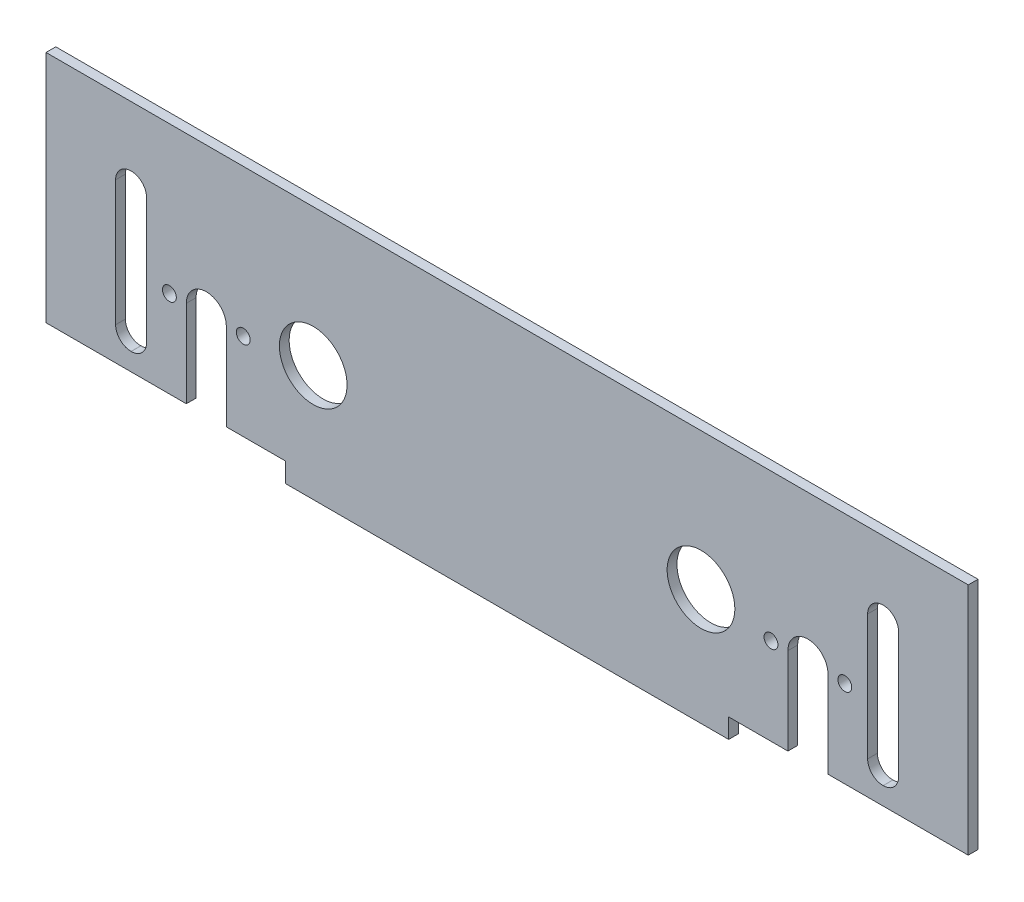
from build123d import *

# Parameters (mm, degrees)
SKETCH1_W            = 299.7
SKETCH1_H            = 76.075
BOSS_EXTRUDE1_DEPTH  = 3.175
CUT_EXTRUDE4_DEPTH   = 155.634907221
CUT_EXTRUDE5_DEPTH   = 155.634907221
M4_CLEARANCE_HOLE1_D = 4.5
SKETCH12_W           = 144
SKETCH12_H           = 3.175
BOSS_EXTRUDE2_DEPTH  = 6.35
SKETCH13_R           = 11
CUT_EXTRUDE6_DEPTH   = 157.318115653


with BuildPart() as part:
    # Sketch1 → Boss-Extrude1 (new body)
    with BuildSketch(Plane.XY):
        Rectangle(SKETCH1_W, SKETCH1_H)
    extrude(amount=BOSS_EXTRUDE1_DEPTH)

    # Sketch8 → Cut-Extrude4 (cut, through all)
    with BuildSketch(Plane.XY.offset(3.175)):
        with BuildLine():
            Line((122.1609, 18.5125), (122.2247, 18.5125))
            ThreePointArc((122.2247, 18.5125), (125.760233906, 17.048033906), (127.2247, 13.5125))
            Line((127.2247, 13.5125), (127.2247, -27.282435401))
            ThreePointArc((127.2247, -27.282435401), (125.760233906, -30.817969307), (122.2247, -32.282435401))
            Line((122.2247, -32.282435401), (122.1609, -32.282435401))
            ThreePointArc((122.1609, -32.282435401), (118.625366094, -30.817969307), (117.1609, -27.282435401))
            Line((117.1609, -27.282435401), (117.1609, 13.5125))
            ThreePointArc((117.1609, 13.5125), (118.625366094, 17.048033906), (122.1609, 18.5125))
        make_face()
    cut_extrude4 = extrude(amount=-CUT_EXTRUDE4_DEPTH, mode=Mode.SUBTRACT)

    # Mirror3: Cut-Extrude4 across plane
    add(cut_extrude4.mirror(Plane(origin=(0, 0, 0), x_dir=(0, 0, 1), z_dir=(1, 0, 0))), mode=Mode.SUBTRACT)

    # Sketch3 → Cut-Extrude5 (cut, through all)
    with BuildSketch(Plane(origin=(0, 0, 0), x_dir=(-1, 0, 0), z_dir=(0, 0, -1))):
        with BuildLine():
            Line((-104.25, -38.0375), (-91.25, -38.0375))
            Line((-91.25, -38.0375), (-91.25, -9.7625))
            ThreePointArc((-91.25, -9.7625), (-97.75, -3.2625), (-104.25, -9.7625))
            Line((-104.25, -9.7625), (-104.25, -38.0375))
        make_face()
        with BuildLine():
            Line((91.25, -38.0375), (104.25, -38.0375))
            Line((104.25, -38.0375), (104.25, -9.7625))
            ThreePointArc((104.25, -9.7625), (97.75, -3.2625), (91.25, -9.7625))
            Line((91.25, -9.7625), (91.25, -38.0375))
        make_face()
    extrude(amount=-CUT_EXTRUDE5_DEPTH, mode=Mode.SUBTRACT)

    # M4 Clearance Hole1 (through all)
    with Locations(Plane(origin=(0, 0, 0), x_dir=(-1, 0, 0), z_dir=(0, 0, -1))):
        with Locations((-85.75, -9.7625), (-109.75, -9.7625), (109.75, -9.7625), (85.75, -9.7625)):
            Hole(M4_CLEARANCE_HOLE1_D / 2)

    # Sketch12 → Boss-Extrude2 (add)
    with BuildSketch(Plane.XZ.offset(38.0375)):
        with Locations((0, 1.5875)):
            Rectangle(SKETCH12_W, SKETCH12_H)
    extrude(amount=BOSS_EXTRUDE2_DEPTH)

    # Sketch13 → Cut-Extrude6 (cut, through all)
    with BuildSketch(Plane(origin=(0, 0, 0), x_dir=(-1, 0, 0), z_dir=(0, 0, -1))):
        with Locations((63.008899223, -6.644651545)):
            Circle(SKETCH13_R)
    cut_extrude6 = extrude(amount=-CUT_EXTRUDE6_DEPTH, mode=Mode.SUBTRACT)

    # Mirror4: Cut-Extrude6 across plane
    add(cut_extrude6.mirror(Plane(origin=(0, 0, 0), x_dir=(0, 0, 1), z_dir=(1, 0, 0))), mode=Mode.SUBTRACT)


solid = part.part
